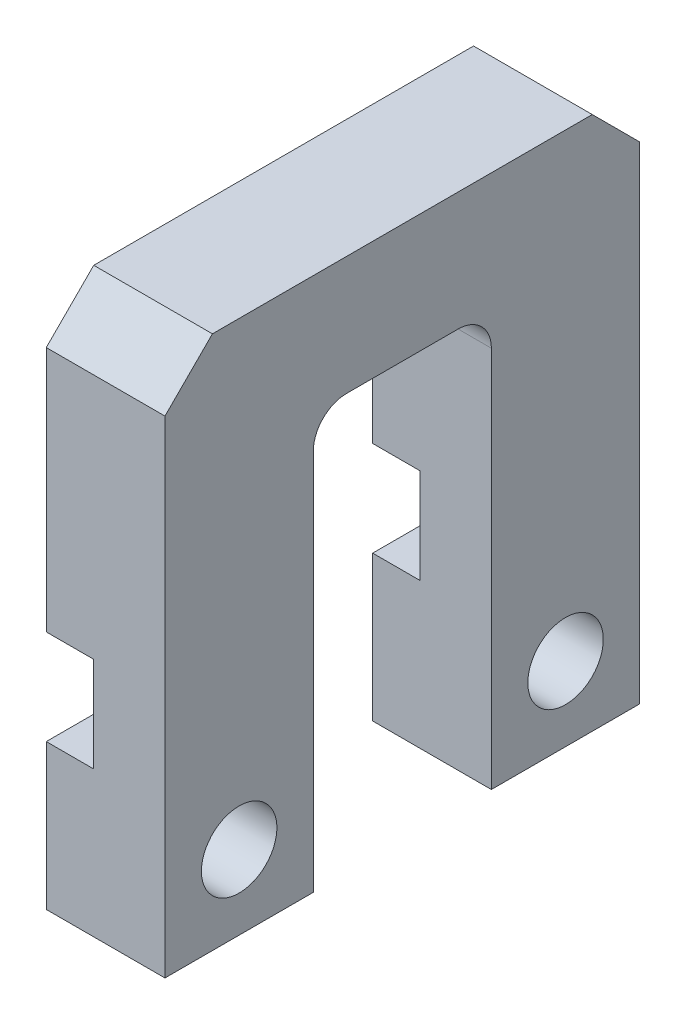
from build123d import *

# Parameters (mm, degrees)
BOSS_EXTRUDE1_DEPTH    = 6.35
F_10_32_TAPPED_HOLE1_D = 4.0386
SKETCH2_W              = 25.4
SKETCH2_H              = 5.08
CUT_EXTRUDE1_DEPTH     = 2.54
CHAMFER1_SIZE          = 2.54


with BuildPart() as part:
    # Sketch1 → Boss-Extrude1 (new body)
    with BuildSketch(Plane(origin=(0, 0, 0), x_dir=(0, 0, -1), z_dir=(1, 0, 0))):
        with BuildLine():
            Line((7.9375, 0), (7.9375, 20.447))
            ThreePointArc((7.9375, 20.447), (8.458264143, 21.704235857), (9.7155, 22.225))
            Line((9.7155, 22.225), (15.6845, 22.225))
            ThreePointArc((15.6845, 22.225), (16.941735857, 21.704235857), (17.4625, 20.447))
            Line((17.4625, 20.447), (17.4625, 0))
            Line((17.4625, 0), (25.4, 0))
            Line((25.4, 0), (25.4, 28.575))
            Line((25.4, 28.575), (0, 28.575))
            Line((0, 28.575), (0, 0))
            Line((0, 0), (7.9375, 0))
        make_face()
    extrude(amount=BOSS_EXTRUDE1_DEPTH)

    # #10-32 Tapped Hole1 (through all)
    with Locations(Plane.ZY):
        with Locations((-21.43125, 3.96875), (-3.96875, 3.96875)):
            Hole(F_10_32_TAPPED_HOLE1_D / 2)

    # Sketch2 → Cut-Extrude1 (cut)
    with BuildSketch(Plane.ZY):
        with Locations((-12.7, 10.31875)):
            Rectangle(SKETCH2_W, SKETCH2_H)
    extrude(amount=-CUT_EXTRUDE1_DEPTH, mode=Mode.SUBTRACT)

    # Chamfer1
    chamfer1_edges = [part.edges().sort_by_distance(p)[0] for p in [
        (3.175, 28.575, -25.4),
        (3.175, 28.575, 0),
    ]]
    chamfer(chamfer1_edges, length=CHAMFER1_SIZE)


solid = part.part
